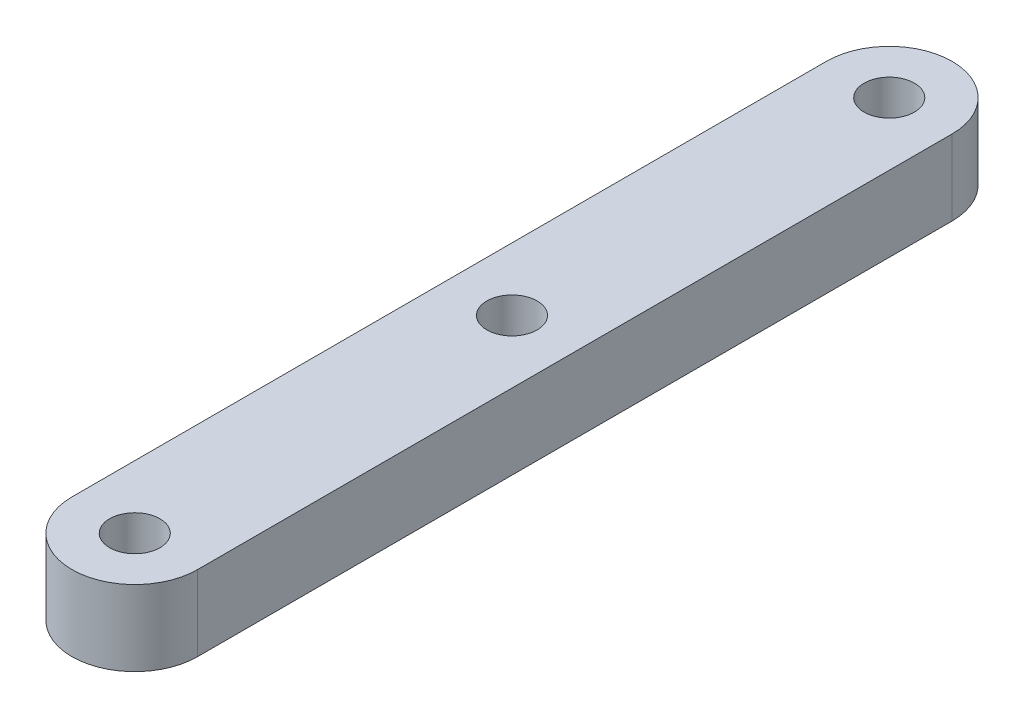
from build123d import *

# Parameters (mm, degrees)
SKETCH1_R           = 1
BOSS_EXTRUDE1_DEPTH = 3


with BuildPart() as part:
    # Sketch1 → Boss-Extrude1 (new body)
    with BuildSketch(Plane(origin=(0, 0, 0), x_dir=(1, 0, 0), z_dir=(0, 1, 0))):
        with BuildLine():
            Line((2.5, 15), (2.5, -15))
            ThreePointArc((2.5, -15), (0, -17.5), (-2.5, -15))
            Line((-2.5, -15), (-2.5, 15))
            ThreePointArc((-2.5, 15), (0, 17.5), (2.5, 15))
        make_face()
        with Locations((0, 15)):
            Circle(SKETCH1_R, mode=Mode.SUBTRACT)
        with Locations((0, -15)):
            Circle(SKETCH1_R, mode=Mode.SUBTRACT)
        Circle(SKETCH1_R, mode=Mode.SUBTRACT)
    extrude(amount=BOSS_EXTRUDE1_DEPTH)


solid = part.part
